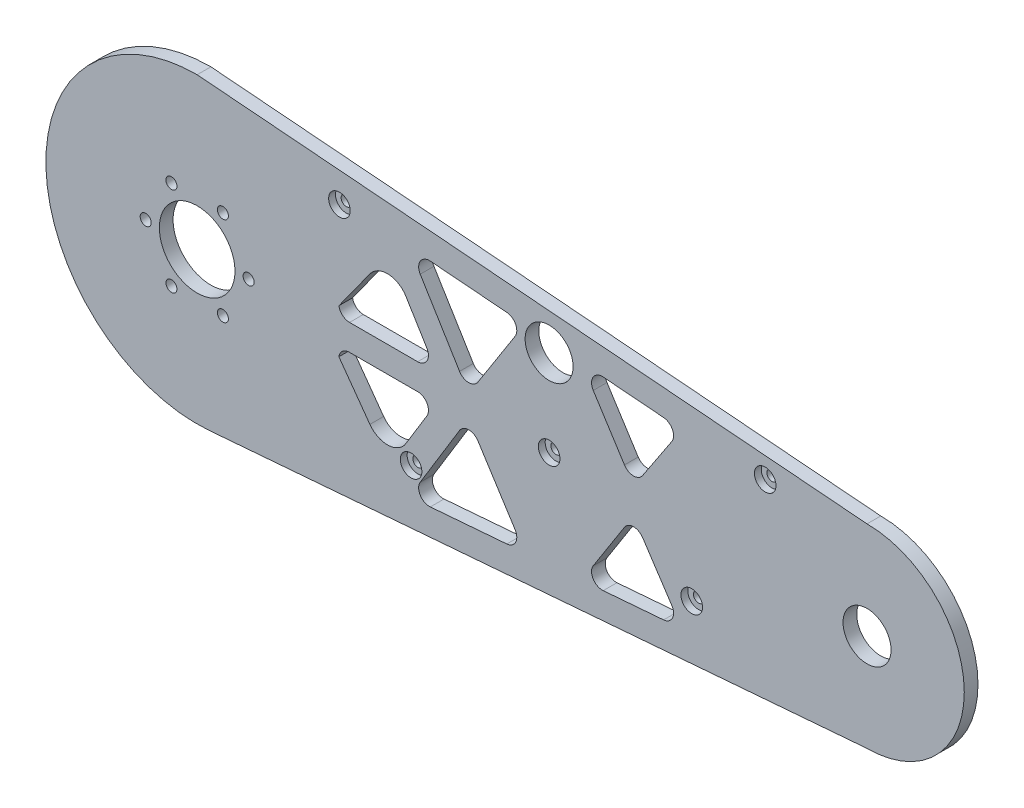
from build123d import *

# Parameters (mm, degrees)
SKETCH1_R             = 14.29385
SKETCH1_R_2           = 11.115
SKETCH1_R_3           = 11.1125
BOSS_EXTRUDE1_DEPTH   = 6.35
CROQUIS1_R            = 2.38125
CORTAR_EXTRUIR1_DEPTH = 50
CROQUIS2_R            = 5
CORTAR_EXTRUIR2_DEPTH = 3.175
CROQUIS4_R            = 5
CORTAR_EXTRUIR3_DEPTH = 3.175
CROQUIS5_R            = 2.38125
CORTAR_EXTRUIR5_DEPTH = 10
CROQUIS6_R            = 2.38125
CORTAR_EXTRUIR6_DEPTH = 10
CROQUIS7_R            = 5
CORTAR_EXTRUIR7_DEPTH = 3.17
CROQUIS8_R            = 17.5
CORTAR_EXTRUIR8_DEPTH = 10
CROQUIS9_R            = 2.5527
CORTAR_EXTRUIR9_DEPTH = 10


with BuildPart() as part:
    # Sketch1 → Boss-Extrude1 (new body)
    with BuildSketch(Plane.XY):
        with BuildLine():
            Line((0, 70), (310, 45))
            ThreePointArc((310, 45), (355, 0), (310, -45))
            Line((310, -45), (5.171398252, -69.808714643))
            ThreePointArc((5.171398252, -69.808714643), (-69.952162315, -2.587467389), (0, 70))
        make_face()
        Circle(SKETCH1_R, mode=Mode.SUBTRACT)
        with Locations((310, 0)):
            Circle(SKETCH1_R_2, mode=Mode.SUBTRACT)
        with Locations((162.878542763, 40)):
            Circle(SKETCH1_R_3, mode=Mode.SUBTRACT)
        with BuildLine():
            Line((107.898974887, 49.259511156), (143.314248041, 46.40344074))
            ThreePointArc((143.314248041, 46.40344074), (147.389908855, 43.644764005), (147.127454118, 38.730252238))
            Line((147.127454118, 38.730252238), (129.916226305, 11.754586611))
            ThreePointArc((129.916226305, 11.754586611), (125.651076231, 9.444205574), (121.433006579, 11.839462159))
            Line((121.433006579, 11.839462159), (103.228961238, 41.671198203))
            ThreePointArc((103.228961238, 41.671198203), (103.238833139, 46.896293531), (107.898974887, 49.259511156))
        make_face(mode=Mode.SUBTRACT)
        with BuildLine():
            Line((70.523244027, 6), (102.03004784, 6))
            ThreePointArc((102.03004784, 6), (106.3902351, 8.552804247), (106.298140539, 13.604493178))
            Line((106.298140539, 13.604493178), (96.590354482, 29.513051181))
            ThreePointArc((96.590354482, 29.513051181), (88.437172177, 34.296727565), (79.941746192, 30.151166228))
            Line((79.941746192, 30.151166228), (65.58297828, 10.229432452))
            ThreePointArc((65.58297828, 10.229432452), (67.271539685, 7.201787411), (70.523244027, 6))
        make_face(mode=Mode.SUBTRACT)
        with BuildLine():
            Line((219.623774494, 32.810522613), (206.130928429, 12.417497436))
            ThreePointArc((206.130928429, 12.417497436), (201.919524559, 10.176643248), (197.745901529, 12.48710226))
            Line((197.745901529, 12.48710226), (183.296864227, 35.133505128))
            ThreePointArc((183.296864227, 35.133505128), (183.227765467, 40.400743015), (187.913912204, 42.80669363))
            Line((187.913912204, 42.80669363), (215.855795571, 40.553315939))
            ThreePointArc((215.855795571, 40.553315939), (219.949772588, 37.757395035), (219.623774494, 32.810522613))
        make_face(mode=Mode.SUBTRACT)
        with BuildLine():
            Line((96.590354482, -29.513051181), (106.298140539, -13.604493178))
            ThreePointArc((106.298140539, -13.604493178), (106.3902351, -8.552804247), (102.03004784, -6))
            Line((102.03004784, -6), (70.523244027, -6))
            ThreePointArc((70.523244027, -6), (67.271539685, -7.201787411), (65.58297828, -10.229432452))
            Line((65.58297828, -10.229432452), (79.941746192, -30.151166228))
            ThreePointArc((79.941746192, -30.151166228), (88.437172177, -34.296727565), (96.590354482, -29.513051181))
        make_face(mode=Mode.SUBTRACT)
        with BuildLine():
            Line((187.913912204, -42.80669363), (215.855795571, -40.553315939))
            ThreePointArc((215.855795571, -40.553315939), (219.949772588, -37.757395035), (219.623774494, -32.810522613))
            Line((219.623774494, -32.810522613), (206.130928429, -12.417497436))
            ThreePointArc((206.130928429, -12.417497436), (201.919524559, -10.176643248), (197.745901529, -12.48710226))
            Line((197.745901529, -12.48710226), (183.296864227, -35.133505128))
            ThreePointArc((183.296864227, -35.133505128), (183.227765467, -40.400743015), (187.913912204, -42.80669363))
        make_face(mode=Mode.SUBTRACT)
        with BuildLine():
            Line((121.433006579, -11.839462159), (103.228961238, -41.671198203))
            ThreePointArc((103.228961238, -41.671198203), (103.238833139, -46.896293531), (107.898974887, -49.259511156))
            Line((107.898974887, -49.259511156), (143.314248041, -46.40344074))
            ThreePointArc((143.314248041, -46.40344074), (147.389908855, -43.644764005), (147.127454118, -38.730252238))
            Line((147.127454118, -38.730252238), (129.916226305, -11.754586611))
            ThreePointArc((129.916226305, -11.754586611), (125.651076231, -9.444205574), (121.433006579, -11.839462159))
        make_face(mode=Mode.SUBTRACT)
    extrude(amount=BOSS_EXTRUDE1_DEPTH)

    # Croquis1 → Cortar-Extruir1 (cut)
    with BuildSketch(Plane.XY.offset(6.35)):
        with Locations((98.995555235, -37.090103176)):
            Circle(CROQUIS1_R)
        with Locations((228.877351461, -26.519571404)):
            Circle(CROQUIS1_R)
    extrude(amount=-CORTAR_EXTRUIR1_DEPTH, mode=Mode.SUBTRACT)

    # Croquis2 → Cortar-Extruir2 (cut)
    with BuildSketch(Plane.XY.offset(6.35)):
        with Locations((98.995555235, -37.090103176)):
            Circle(CROQUIS2_R)
        with Locations((228.877351461, -26.519571404)):
            Circle(CROQUIS2_R)
    extrude(amount=-CORTAR_EXTRUIR2_DEPTH, mode=Mode.SUBTRACT)

    # Croquis4 → Cortar-Extruir3 (cut)
    with BuildSketch(Plane.XY.offset(6.35)):
        with Locations((162.878542763, 0)):
            Circle(CROQUIS4_R)
    extrude(amount=-CORTAR_EXTRUIR3_DEPTH, mode=Mode.SUBTRACT)

    # Croquis5 → Cortar-Extruir5 (cut)
    with BuildSketch(Plane.XY.offset(6.35)):
        with Locations((162.878542763, 0)):
            Circle(CROQUIS5_R)
    extrude(amount=-CORTAR_EXTRUIR5_DEPTH, mode=Mode.SUBTRACT)

    # Croquis6 → Cortar-Extruir6 (cut)
    with BuildSketch(Plane.XY.offset(6.35)):
        with Locations((65.84135797, 50.868973694)):
            Circle(CROQUIS6_R)
        with Locations((262.871569637, 39.210126075)):
            Circle(CROQUIS6_R)
    extrude(amount=-CORTAR_EXTRUIR6_DEPTH, mode=Mode.SUBTRACT)

    # Croquis7 → Cortar-Extruir7 (cut)
    with BuildSketch(Plane.XY.offset(6.35)):
        with Locations((65.84135797, 50.868973694)):
            Circle(CROQUIS7_R)
        with Locations((262.871569637, 39.210126075)):
            Circle(CROQUIS7_R)
    extrude(amount=-CORTAR_EXTRUIR7_DEPTH, mode=Mode.SUBTRACT)

    # Croquis8 → Cortar-Extruir8 (cut)
    with BuildSketch(Plane.XY.offset(6.35)):
        Circle(CROQUIS8_R)
    extrude(amount=-CORTAR_EXTRUIR8_DEPTH, mode=Mode.SUBTRACT)

    # Croquis9 → Cortar-Extruir9 (cut)
    with BuildSketch(Plane(origin=(0, 0, 0), x_dir=(-1, 0, 0), z_dir=(0, 0, -1))):
        with Locations((23.8125, 0)):
            Circle(CROQUIS9_R)
        with Locations((11.90625, -20.622229928)):
            Circle(CROQUIS9_R)
        with Locations((-11.90625, -20.622229928)):
            Circle(CROQUIS9_R)
        with Locations((-23.8125, 0)):
            Circle(CROQUIS9_R)
        with Locations((-11.90625, 20.622229928)):
            Circle(CROQUIS9_R)
        with Locations((11.90625, 20.622229928)):
            Circle(CROQUIS9_R)
    extrude(amount=-CORTAR_EXTRUIR9_DEPTH, mode=Mode.SUBTRACT)


solid = part.part
